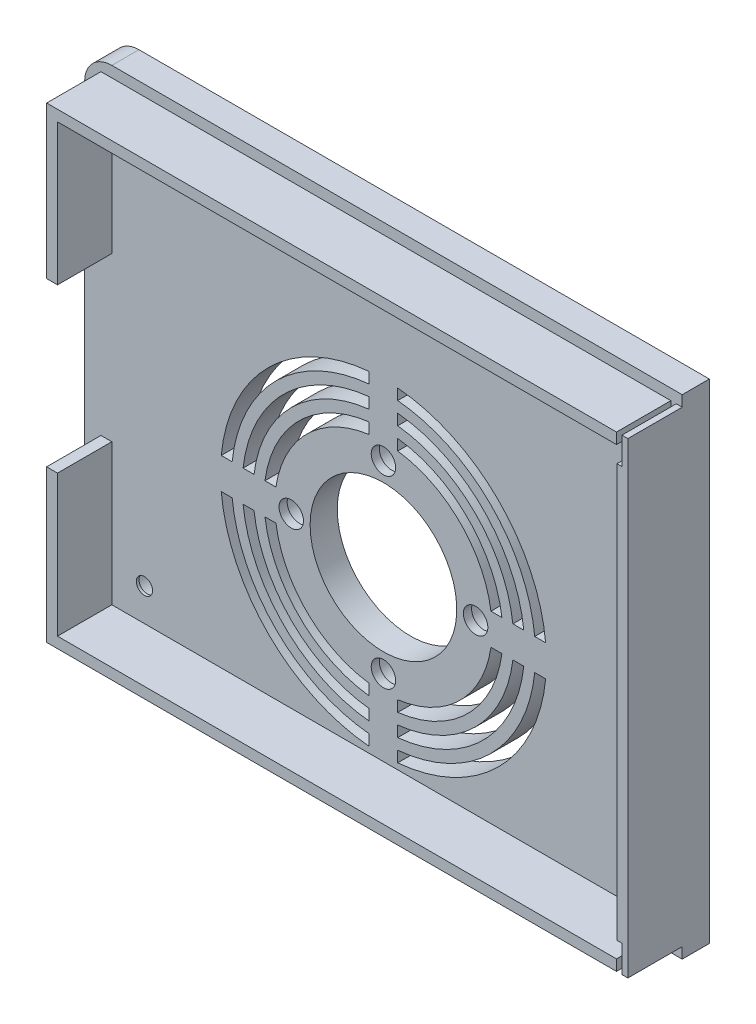
from build123d import *

# Parameters (mm, degrees)
SKETCH1_W           = 110
SKETCH1_H           = 90
BOSS_EXTRUDE1_DEPTH = 5
CUT_EXTRUDE5_REACH  = 73.239
SKETCH6_R           = 1.5
SKETCH7_R           = 3
CUT_EXTRUDE6_DEPTH  = 3
FILLET2_R           = 5
BOSS_EXTRUDE2_DEPTH = 10
CHAMFER1_SIZE       = 1.5
CHAMFER1_SIZE_2     = 2.598076211
CHAMFER2_SIZE       = 1.5
CHAMFER2_SIZE_2     = 2.598076211
CUT_EXTRUDE7_REACH  = 74.629
SKETCH14_R          = 2.25
SKETCH15_R          = 3
CUT_EXTRUDE8_DEPTH  = 3.5
SKETCH16_W          = 5.25
SKETCH16_H          = 5.75
CUT_EXTRUDE9_DEPTH  = 40.5
CUT_EXTRUDE10_REACH = 74.629
SKETCH17_R          = 13.5
SKETCH18_W          = 1
SKETCH18_H          = 5
CUT_EXTRUDE11_DEPTH = 10


with BuildPart() as part:
    # Sketch1 → Boss-Extrude1 (new body)
    with BuildSketch(Plane.XY):
        Rectangle(SKETCH1_W, SKETCH1_H)
    extrude(amount=BOSS_EXTRUDE1_DEPTH)

    # Sketch6 → Cut-Extrude5 (cut, up to next)
    with BuildSketch(Plane.XY.offset(5), mode=Mode.PRIVATE) as cut_extrude5_sk1:
        with Locations((-44, 35)):
            Circle(SKETCH6_R)
    cut_extrude5_tool1 = extrude(cut_extrude5_sk1.sketch, amount=-CUT_EXTRUDE5_REACH, mode=Mode.PRIVATE) & part.part
    # Sketch6 → Cut-Extrude5 (cut, up to next)
    with BuildSketch(Plane.XY.offset(5), mode=Mode.PRIVATE) as cut_extrude5_sk2:
        with Locations((-44, -35)):
            Circle(SKETCH6_R)
    cut_extrude5_tool2 = extrude(cut_extrude5_sk2.sketch, amount=-CUT_EXTRUDE5_REACH, mode=Mode.PRIVATE) & part.part
    add(cut_extrude5_tool1.solids().sort_by_distance((-44, 35, 5))[0], mode=Mode.SUBTRACT)
    add(cut_extrude5_tool2.solids().sort_by_distance((-44, -35, 5))[0], mode=Mode.SUBTRACT)

    # Sketch7 → Cut-Extrude6 (cut)
    with BuildSketch(Plane(origin=(0, 0, 0), x_dir=(-1, 0, 0), z_dir=(0, 0, -1))):
        with Locations((44, 35)):
            Circle(SKETCH7_R)
        with Locations((44, -35)):
            Circle(SKETCH7_R)
    extrude(amount=-CUT_EXTRUDE6_DEPTH, mode=Mode.SUBTRACT)

    # Fillet2
    fillet2_edges = [part.edges().sort_by_distance(p)[0] for p in [
        (-55, 45, 2.5),
        (-55, -45, 2.5),
    ]]
    fillet(fillet2_edges, radius=FILLET2_R)

    # Sketch12 → Boss-Extrude2 (add)
    with BuildSketch(Plane.XY.offset(5)):
        Polygon((-52, -43), (55, -43), (55, 43), (-52, 43), (-52, 15), (-50, 15), (-50, 41), (53, 41), (53, -41), (-50, -41), (-50, -15), (-52, -15), align=None)
    extrude(amount=BOSS_EXTRUDE2_DEPTH)

    # Chamfer1
    # the kernel refuses this chamfer: 2.598076211, 1.5 mm, written as the material it takes off along each edge
    with BuildSketch(Plane(origin=(-44, 35, 3), x_dir=(1, 0, 0), z_dir=(0, -1, 0))) as chamfer1_piece_1_section:
        Polygon((1.5, CHAMFER1_SIZE), (1.5 + CHAMFER1_SIZE_2, 0), (1.5, 0), align=None)
    chamfer1_piece_1 = revolve(axis=Axis((-44, 35, 3), (0, 0, 1)), mode=Mode.PRIVATE)
    chamfer1_piece_1 = chamfer1_piece_1 & Plane(origin=(-44, 35, 4.068135077), x_dir=(-1, 0, 0), z_dir=(0, 0, -1)) * Cylinder(3, 17, mode=Mode.PRIVATE)
    add(chamfer1_piece_1, mode=Mode.SUBTRACT)

    # Chamfer2
    # the kernel refuses this chamfer: 2.598076211, 1.5 mm, written as the material it takes off along each edge
    with BuildSketch(Plane(origin=(-44, -35, 3), x_dir=(1, 0, 0), z_dir=(0, -1, 0))) as chamfer2_piece_1_section:
        Polygon((1.5, CHAMFER2_SIZE), (1.5 + CHAMFER2_SIZE_2, 0), (1.5, 0), align=None)
    chamfer2_piece_1 = revolve(axis=Axis((-44, -35, 3), (0, 0, 1)), mode=Mode.PRIVATE)
    chamfer2_piece_1 = chamfer2_piece_1 & Plane(origin=(-44, -35, 4.068135077), x_dir=(-1, 0, 0), z_dir=(0, 0, -1)) * Cylinder(3, 17, mode=Mode.PRIVATE)
    add(chamfer2_piece_1, mode=Mode.SUBTRACT)

    # Sketch14 → Cut-Extrude7 (cut, up to next)
    with BuildSketch(Plane(origin=(0, 0, 0), x_dir=(-1, 0, 0), z_dir=(0, 0, -1)), mode=Mode.PRIVATE) as cut_extrude7_sk1:
        with Locations((0, 6.97)):
            Circle(SKETCH14_R)
    cut_extrude7_tool1 = extrude(cut_extrude7_sk1.sketch, amount=-CUT_EXTRUDE7_REACH, mode=Mode.PRIVATE) & part.part
    # Sketch14 → Cut-Extrude7 (cut, up to next)
    with BuildSketch(Plane(origin=(0, 0, 0), x_dir=(-1, 0, 0), z_dir=(0, 0, -1)), mode=Mode.PRIVATE) as cut_extrude7_sk2:
        with Locations((16.97, -10)):
            Circle(SKETCH14_R)
    cut_extrude7_tool2 = extrude(cut_extrude7_sk2.sketch, amount=-CUT_EXTRUDE7_REACH, mode=Mode.PRIVATE) & part.part
    # Sketch14 → Cut-Extrude7 (cut, up to next)
    with BuildSketch(Plane(origin=(0, 0, 0), x_dir=(-1, 0, 0), z_dir=(0, 0, -1)), mode=Mode.PRIVATE) as cut_extrude7_sk3:
        with Locations((0, -26.97)):
            Circle(SKETCH14_R)
    cut_extrude7_tool3 = extrude(cut_extrude7_sk3.sketch, amount=-CUT_EXTRUDE7_REACH, mode=Mode.PRIVATE) & part.part
    # Sketch14 → Cut-Extrude7 (cut, up to next)
    with BuildSketch(Plane(origin=(0, 0, 0), x_dir=(-1, 0, 0), z_dir=(0, 0, -1)), mode=Mode.PRIVATE) as cut_extrude7_sk4:
        with Locations((-16.97, -10)):
            Circle(SKETCH14_R)
    cut_extrude7_tool4 = extrude(cut_extrude7_sk4.sketch, amount=-CUT_EXTRUDE7_REACH, mode=Mode.PRIVATE) & part.part
    add(cut_extrude7_tool1.solids().sort_by_distance((0, 6.97, 0))[0], mode=Mode.SUBTRACT)
    add(cut_extrude7_tool2.solids().sort_by_distance((-16.97, -10, 0))[0], mode=Mode.SUBTRACT)
    add(cut_extrude7_tool3.solids().sort_by_distance((0, -26.97, 0))[0], mode=Mode.SUBTRACT)
    add(cut_extrude7_tool4.solids().sort_by_distance((16.97, -10, 0))[0], mode=Mode.SUBTRACT)

    # Sketch15 → Cut-Extrude8 (cut)
    with BuildSketch(Plane(origin=(0, 0, 0), x_dir=(-1, 0, 0), z_dir=(0, 0, -1))):
        with Locations((0, 6.97)):
            Circle(SKETCH15_R)
        with Locations((0, -26.97)):
            Circle(SKETCH15_R)
        with Locations((-16.97, -10)):
            Circle(SKETCH15_R)
        with Locations((16.97, -10)):
            Circle(SKETCH15_R)
    extrude(amount=-CUT_EXTRUDE8_DEPTH, mode=Mode.SUBTRACT)

    # Sketch16 → Cut-Extrude9 (cut)
    with BuildSketch(Plane.XY.offset(5)):
        with BuildLine():
            ThreePointArc((12.165753201, -7.125076435), (8.748632168, -1.071097601), (2.625870341, 2.221190888))
            Line((2.625870341, 2.221190888), (2.625870341, -2.36365057))
            ThreePointArc((2.625870341, -2.36365057), (5.615974196, -4.196953681), (7.546730133, -7.125076435))
            Line((7.546730133, -7.125076435), (12.165753201, -7.125076435))
        make_face()
        with BuildLine():
            ThreePointArc((12.500870341, -10.000076435), (12.4168084, -8.552843861), (12.165753201, -7.125076435))
            Line((12.165753201, -7.125076435), (7.546730133, -7.125076435))
            ThreePointArc((7.546730133, -7.125076435), (7.942483616, -8.538432296), (8.075870341, -10.000076435))
            ThreePointArc((8.075870341, -10.000076435), (7.942483616, -11.461720575), (7.546730133, -12.875076435))
            Line((7.546730133, -12.875076435), (12.165753201, -12.875076435))
            ThreePointArc((12.165753201, -12.875076435), (12.4168084, -11.44730901), (12.500870341, -10.000076435))
        make_face()
        with BuildLine():
            Line((-7.544989451, -7.125076435), (-12.164012519, -7.125076435))
            ThreePointArc((-12.164012519, -7.125076435), (-12.499129659, -10.000076435), (-12.164012519, -12.875076435))
            Line((-12.164012519, -12.875076435), (-7.544989451, -12.875076435))
            ThreePointArc((-7.544989451, -12.875076435), (-8.074129659, -10.000076435), (-7.544989451, -7.125076435))
        make_face()
        with BuildLine():
            Line((-7.544989451, -12.875076435), (-12.164012519, -12.875076435))
            ThreePointArc((-12.164012519, -12.875076435), (-8.746891485, -18.92905527), (-2.624129659, -22.221343759))
            Line((-2.624129659, -22.221343759), (-2.624129659, -17.636502301))
            ThreePointArc((-2.624129659, -17.636502301), (-5.614233513, -15.80319919), (-7.544989451, -12.875076435))
        make_face()
        with BuildLine():
            Line((-2.624129659, -2.36365057), (-2.624129659, 2.221190888))
            ThreePointArc((-2.624129659, 2.221190888), (-8.746891485, -1.071097601), (-12.164012519, -7.125076435))
            Line((-12.164012519, -7.125076435), (-7.544989451, -7.125076435))
            ThreePointArc((-7.544989451, -7.125076435), (-5.614233513, -4.196953681), (-2.624129659, -2.36365057))
        make_face()
        with BuildLine():
            Line((-2.624129659, 9.826909594), (-2.624129659, 11.842757058))
            ThreePointArc((-2.624129659, 11.842757058), (-15.46613665, 5.645104763), (-21.810465587, -7.125076435))
            Line((-21.810465587, -7.125076435), (-19.791410351, -7.125076435))
            ThreePointArc((-19.791410351, -7.125076435), (-14.051747777, 4.231013615), (-2.624129659, 9.826909594))
        make_face()
        with BuildLine():
            Line((-2.624129659, 13.855936958), (-2.624129659, 15.867072132))
            ThreePointArc((-2.624129659, 15.867072132), (-18.29480414, 8.473371951), (-25.839686444, -7.125076435))
            Line((-25.839686444, -7.125076435), (-23.826306894, -7.125076435))
            ThreePointArc((-23.826306894, -7.125076435), (-16.880484784, 7.059227452), (-2.624129659, 13.855936958))
        make_face()
        with BuildLine():
            Line((-2.624129659, 17.876605128), (-2.624129659, 19.884859151))
            ThreePointArc((-2.624129659, 19.884859151), (-21.123385326, 11.301703362), (-29.861051482, -7.125076435))
            Line((-29.861051482, -7.125076435), (-27.851138114, -7.125076435))
            ThreePointArc((-27.851138114, -7.125076435), (-19.709102549, 9.887531984), (-2.624129659, 17.876605128))
        make_face()
        with BuildLine():
            ThreePointArc((21.81220627, -7.125076435), (15.467877332, 5.645104763), (2.625870341, 11.842757058))
            Line((2.625870341, 11.842757058), (2.625870341, 9.826909594))
            ThreePointArc((2.625870341, 9.826909594), (14.05348846, 4.231013615), (19.793151034, -7.125076435))
            Line((19.793151034, -7.125076435), (21.81220627, -7.125076435))
        make_face()
        with BuildLine():
            ThreePointArc((25.841427127, -7.125076435), (18.296544822, 8.473371951), (2.625870341, 15.867072132))
            Line((2.625870341, 15.867072132), (2.625870341, 13.855936958))
            ThreePointArc((2.625870341, 13.855936958), (16.882225467, 7.059227452), (23.828047577, -7.125076435))
            Line((23.828047577, -7.125076435), (25.841427127, -7.125076435))
        make_face()
        with BuildLine():
            ThreePointArc((29.862792165, -7.125076435), (21.125126008, 11.301703362), (2.625870341, 19.884859151))
            Line((2.625870341, 19.884859151), (2.625870341, 17.876605128))
            ThreePointArc((2.625870341, 17.876605128), (19.710843232, 9.887531984), (27.852878797, -7.125076435))
            Line((27.852878797, -7.125076435), (29.862792165, -7.125076435))
        make_face()
        with BuildLine():
            ThreePointArc((2.625870341, -31.842909928), (15.467877332, -25.645257634), (21.81220627, -12.875076435))
            Line((21.81220627, -12.875076435), (19.793151034, -12.875076435))
            ThreePointArc((19.793151034, -12.875076435), (14.05348846, -24.231166485), (2.625870341, -29.827062464))
            Line((2.625870341, -29.827062464), (2.625870341, -31.842909928))
        make_face()
        with BuildLine():
            ThreePointArc((2.625870341, -35.867225003), (18.296544822, -28.473524822), (25.841427127, -12.875076435))
            Line((25.841427127, -12.875076435), (23.828047577, -12.875076435))
            ThreePointArc((23.828047577, -12.875076435), (16.882225467, -27.059380323), (2.625870341, -33.856089828))
            Line((2.625870341, -33.856089828), (2.625870341, -35.867225003))
        make_face()
        with BuildLine():
            Line((29.862792165, -12.875076435), (27.852878797, -12.875076435))
            ThreePointArc((27.852878797, -12.875076435), (19.710843232, -29.887684855), (2.625870341, -37.876757999))
            Line((2.625870341, -37.876757999), (2.625870341, -39.885012022))
            ThreePointArc((2.625870341, -39.885012022), (21.125126008, -31.301856232), (29.862792165, -12.875076435))
        make_face()
        with BuildLine():
            Line((-27.851138114, -12.875076435), (-29.861051482, -12.875076435))
            ThreePointArc((-29.861051482, -12.875076435), (-21.123385326, -31.301856232), (-2.624129659, -39.885012022))
            Line((-2.624129659, -39.885012022), (-2.624129659, -37.876757999))
            ThreePointArc((-2.624129659, -37.876757999), (-19.709102549, -29.887684855), (-27.851138114, -12.875076435))
        make_face()
        with BuildLine():
            Line((-23.826306894, -12.875076435), (-25.839686444, -12.875076435))
            ThreePointArc((-25.839686444, -12.875076435), (-18.29480414, -28.473524822), (-2.624129659, -35.867225003))
            Line((-2.624129659, -35.867225003), (-2.624129659, -33.856089828))
            ThreePointArc((-2.624129659, -33.856089828), (-16.880484784, -27.059380323), (-23.826306894, -12.875076435))
        make_face()
        with BuildLine():
            Line((-19.791410351, -12.875076435), (-21.810465587, -12.875076435))
            ThreePointArc((-21.810465587, -12.875076435), (-15.46613665, -25.645257634), (-2.624129659, -31.842909928))
            Line((-2.624129659, -31.842909928), (-2.624129659, -29.827062464))
            ThreePointArc((-2.624129659, -29.827062464), (-14.051747777, -24.231166485), (-19.791410351, -12.875076435))
        make_face()
        with BuildLine():
            ThreePointArc((2.625870341, -22.221343759), (8.748632168, -18.92905527), (12.165753201, -12.875076435))
            Line((12.165753201, -12.875076435), (7.546730133, -12.875076435))
            ThreePointArc((7.546730133, -12.875076435), (5.615974196, -15.80319919), (2.625870341, -17.636502301))
            Line((2.625870341, -17.636502301), (2.625870341, -22.221343759))
        make_face()
        with BuildLine():
            Line((-2.624129659, -7.125076435), (-2.624129659, -2.36365057))
            ThreePointArc((-2.624129659, -2.36365057), (-5.614233513, -4.196953681), (-7.544989451, -7.125076435))
            Line((-7.544989451, -7.125076435), (-2.624129659, -7.125076435))
        make_face()
        with BuildLine():
            Line((-2.624129659, -12.875076435), (-2.624129659, -7.125076435))
            Line((-2.624129659, -7.125076435), (-7.544989451, -7.125076435))
            ThreePointArc((-7.544989451, -7.125076435), (-8.074129659, -10.000076435), (-7.544989451, -12.875076435))
            Line((-7.544989451, -12.875076435), (-2.624129659, -12.875076435))
        make_face()
        with BuildLine():
            Line((-2.624129659, -17.636502301), (-2.624129659, -12.875076435))
            Line((-2.624129659, -12.875076435), (-7.544989451, -12.875076435))
            ThreePointArc((-7.544989451, -12.875076435), (-5.614233513, -15.80319919), (-2.624129659, -17.636502301))
        make_face()
        with BuildLine():
            Line((7.546730133, -12.875076435), (2.625870341, -12.875076435))
            Line((2.625870341, -12.875076435), (2.625870341, -17.636502301))
            ThreePointArc((2.625870341, -17.636502301), (5.615974196, -15.80319919), (7.546730133, -12.875076435))
        make_face()
        with BuildLine():
            ThreePointArc((7.546730133, -7.125076435), (5.615974196, -4.196953681), (2.625870341, -2.36365057))
            Line((2.625870341, -2.36365057), (2.625870341, -7.125076435))
            Line((2.625870341, -7.125076435), (7.546730133, -7.125076435))
        make_face()
        with BuildLine():
            Line((7.546730133, -7.125076435), (2.625870341, -7.125076435))
            Line((2.625870341, -7.125076435), (2.625870341, -12.875076435))
            Line((2.625870341, -12.875076435), (7.546730133, -12.875076435))
            ThreePointArc((7.546730133, -12.875076435), (7.942483616, -11.461720575), (8.075870341, -10.000076435))
            ThreePointArc((8.075870341, -10.000076435), (7.942483616, -8.538432296), (7.546730133, -7.125076435))
        make_face()
        with BuildLine():
            Line((2.625870341, -2.36365057), (2.625870341, 2.221190888))
            ThreePointArc((2.625870341, 2.221190888), (0.000870341, 2.499923565), (-2.624129659, 2.221190888))
            Line((-2.624129659, 2.221190888), (-2.624129659, -2.36365057))
            ThreePointArc((-2.624129659, -2.36365057), (0.000870341, -1.925076435), (2.625870341, -2.36365057))
        make_face()
        with BuildLine():
            Line((-2.624129659, -17.636502301), (-2.624129659, -22.221343759))
            ThreePointArc((-2.624129659, -22.221343759), (0.000870341, -22.500076435), (2.625870341, -22.221343759))
            Line((2.625870341, -22.221343759), (2.625870341, -17.636502301))
            ThreePointArc((2.625870341, -17.636502301), (0.000870341, -18.075076435), (-2.624129659, -17.636502301))
        make_face()
        with BuildLine():
            Line((2.625870341, -7.125076435), (2.625870341, -2.36365057))
            ThreePointArc((2.625870341, -2.36365057), (0.000870341, -1.925076435), (-2.624129659, -2.36365057))
            Line((-2.624129659, -2.36365057), (-2.624129659, -7.125076435))
            Line((-2.624129659, -7.125076435), (2.625870341, -7.125076435))
        make_face()
        with BuildLine():
            Line((2.625870341, -17.636502301), (2.625870341, -12.875076435))
            Line((2.625870341, -12.875076435), (-2.624129659, -12.875076435))
            Line((-2.624129659, -12.875076435), (-2.624129659, -17.636502301))
            ThreePointArc((-2.624129659, -17.636502301), (0.000870341, -18.075076435), (2.625870341, -17.636502301))
        make_face()
        with Locations((0.000870341, -10.000076435)):
            Rectangle(SKETCH16_W, SKETCH16_H)
    extrude(amount=-CUT_EXTRUDE9_DEPTH, mode=Mode.SUBTRACT)

    # Sketch17 → Cut-Extrude10 (cut, up to next)
    with BuildSketch(Plane(origin=(0, 0, 0), x_dir=(-1, 0, 0), z_dir=(0, 0, -1)), mode=Mode.PRIVATE) as cut_extrude10_sk1:
        with Locations((-0.000870341, -10.000076435)):
            Circle(SKETCH17_R)
    cut_extrude10_tool1 = extrude(cut_extrude10_sk1.sketch, amount=-CUT_EXTRUDE10_REACH, mode=Mode.PRIVATE) & part.part
    add(cut_extrude10_tool1.solids().sort_by_distance((0.00087, -10.000076, 0))[0], mode=Mode.SUBTRACT)

    # Sketch18 → Cut-Extrude11 (cut)
    with BuildSketch(Plane.XY.offset(15)):
        with Locations((53.408916869, -40.5)):
            Rectangle(SKETCH18_W, SKETCH18_H)
        with Locations((53.408916869, 40.5)):
            Rectangle(SKETCH18_W, SKETCH18_H)
    extrude(amount=-CUT_EXTRUDE11_DEPTH, mode=Mode.SUBTRACT)


solid = part.part
